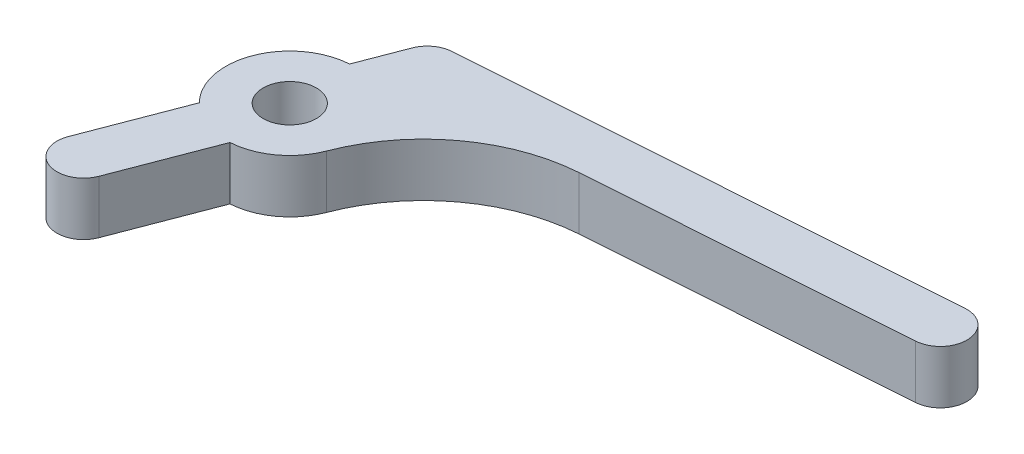
from build123d import *

# Parameters (mm, degrees)
SKETCH1_R           = 3.175
BOSS_EXTRUDE1_DEPTH = 6.35


with BuildPart() as part:
    # Sketch1 → Boss-Extrude1 (new body)
    with BuildSketch(Plane(origin=(0, 0, 0), x_dir=(1, 0, 0), z_dir=(0, 1, 0))):
        with BuildLine():
            ThreePointArc((0.48397148, -7.621514688), (4.526523941, -6.150796334), (7.132828761, -2.728455313))
            ThreePointArc((7.132828761, -2.728455313), (13.906300834, 6.200799727), (24.416674474, 10.092273154))
            Line((24.416674474, 10.092273154), (61.912569184, 12.758377306))
            ThreePointArc((61.912569184, 12.758377306), (64.854387126, 16.150567925), (61.462196506, 19.092385867))
            Line((61.462196506, 19.092385867), (4.312196506, 15.028798281))
            ThreePointArc((4.312196506, 15.028798281), (2.645832454, 14.411825788), (1.571934345, 12.996139712))
            Line((1.571934345, 12.996139712), (-0.48397148, 7.621514688))
            ThreePointArc((-0.48397148, 7.621514688), (-7.132828761, 2.728455313), (-5.44692552, -5.352823265))
            Line((-5.44692552, -5.352823265), (-9.771522768, -16.65834529))
            ThreePointArc((-9.771522768, -16.65834529), (-7.940419979, -20.758139501), (-3.840625768, -18.927036712))
            Line((-3.840625768, -18.927036712), (0.48397148, -7.621514688))
        make_face()
        Circle(SKETCH1_R, mode=Mode.SUBTRACT)
    extrude(amount=BOSS_EXTRUDE1_DEPTH)


solid = part.part
